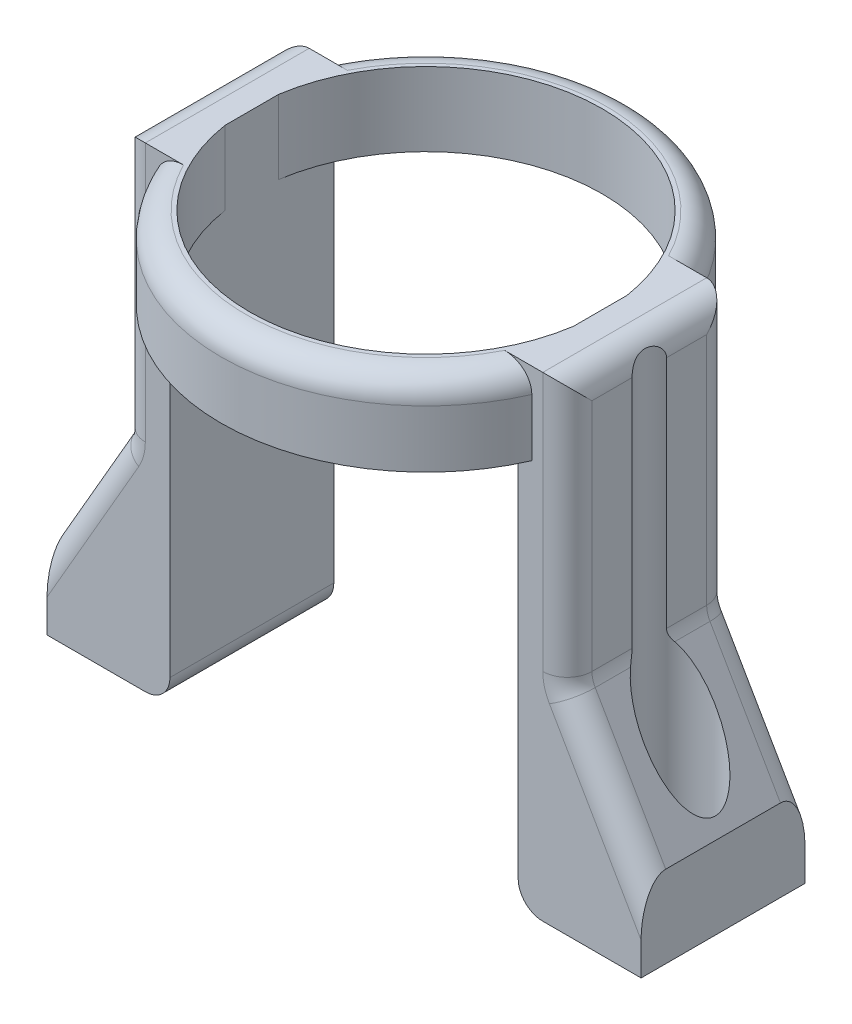
from build123d import *
from OCP.BRepFilletAPI import BRepFilletAPI_MakeChamfer

# Parameters (mm, degrees)
SKETCH_1_R          = 25
SKETCH_1_R_2        = 21.5
EXTRUDE_1_DEPTH     = 10
SKETCH_2_W          = 6
SKETCH_2_H          = 20
EXTRUDE_2_DEPTH     = 58
SKETCH_3_W          = 15
SKETCH_3_H          = 20
EXTRUDE_3_DEPTH     = 10
SKETCH_4_R          = 2.3
CUT_EXTRUDE_1_DEPTH = 73.822129192
CHAMFER_2_SIZE      = 15.588457268
CHAMFER_2_SIZE_2    = 9
FILLET_1_R          = 3
SKETCH_5_R          = 4.3
CUT_EXTRUDE_2_DEPTH = 55
CHAMFER_3_SIZE      = 1
CHAMFER_3_SIZE2     = 1.732050808


with BuildPart() as part:
    # Эскиз1 → Бобышка-Вытянуть1 (new body)
    with BuildSketch(Plane(origin=(0, 0, 0), x_dir=(1, 0, 0), z_dir=(0, 1, 0))):
        with Locations(Location((0, 0, 0), (0, 0, 270))):
            Circle(SKETCH_1_R)
        with Locations(Location((0, 0, 0), (0, 0, 270))):
            Circle(SKETCH_1_R_2, mode=Mode.SUBTRACT)
    extrude(amount=EXTRUDE_1_DEPTH)

    # Эскиз2 → Бобышка-Вытянуть2 (add)
    with BuildSketch(Plane(origin=(0, 10, 0), x_dir=(-1, 0, 0), z_dir=(0, -1, 0))):
        with Locations((-24.25, 0)):
            Rectangle(SKETCH_2_W, SKETCH_2_H)
        with Locations((24.25, 0)):
            Rectangle(SKETCH_2_W, SKETCH_2_H)
    extrude(amount=EXTRUDE_2_DEPTH)

    # Эскиз3 → Бобышка-Вытянуть3 (add)
    with BuildSketch(Plane.XZ.offset(48)):
        with Locations((28.75, 0)):
            Rectangle(SKETCH_3_W, SKETCH_3_H)
        with Locations((-28.75, 0)):
            Rectangle(SKETCH_3_W, SKETCH_3_H)
    extrude(amount=-EXTRUDE_3_DEPTH)

    # Эскиз4 → Вырез-Вытянуть1 (cut, through all)
    with BuildSketch(Plane.XZ.offset(48)):
        with Locations(Location((31, 0, 0), (0, 0, 270))):
            Circle(SKETCH_4_R)
        with Locations(Location((-31, 0, 0), (0, 0, 270))):
            Circle(SKETCH_4_R)
    extrude(amount=-CUT_EXTRUDE_1_DEPTH, mode=Mode.SUBTRACT)

    # Фаска2
    # the kernel refuses this chamfer: 15.588457268, 9 mm, written as the material it adds along each edge
    with BuildSketch(Plane(origin=(27.25, -38, 10), x_dir=(-0.01932676561270058, 0.9998132206222079, 0), z_dir=(0, 0, -1))) as chamfer_2_piece_1_section:
        Polygon((CHAMFER_2_SIZE * 0.99981322063, CHAMFER_2_SIZE * 0.0193267656128), (-CHAMFER_2_SIZE_2 * 0.0193267656127, CHAMFER_2_SIZE_2 * 0.999813220622), (0, 0), align=None)
    chamfer_2_piece_1 = extrude(amount=20, mode=Mode.PRIVATE)
    chamfer_2_piece_1 = split(chamfer_2_piece_1, bisect_by=Plane(origin=(36.25, -24.615994123, -6.666666667), z_dir=(-1, 0, 0)), keep=Keep.TOP, mode=Mode.PRIVATE)
    chamfer_2_piece_1 = chamfer_2_piece_1 - Plane(origin=(31, -24.615994123, 0), x_dir=(0, 0, -1), z_dir=(0, -1, 0)) * Cylinder(2.3, 103, mode=Mode.PRIVATE)
    add(chamfer_2_piece_1)
    with BuildSketch(Plane(origin=(-27.25, -38, -10), x_dir=(-0.9983227437537927, -0.0578938624026717, 0), z_dir=(0, 0, 1))) as chamfer_2_piece_2_section:
        Polygon((CHAMFER_2_SIZE_2 * 0.998322743754, -CHAMFER_2_SIZE_2 * 0.0578938624027), (-CHAMFER_2_SIZE * 0.0578938624031, -CHAMFER_2_SIZE * 0.998322743761), (0, 0), align=None)
    chamfer_2_piece_2 = extrude(amount=20, mode=Mode.PRIVATE)
    chamfer_2_piece_2 = split(chamfer_2_piece_2, bisect_by=Plane(origin=(-36.25, -35.368298987, 6.666666667), z_dir=(1, 0, 0)), keep=Keep.TOP, mode=Mode.PRIVATE)
    chamfer_2_piece_2 = chamfer_2_piece_2 - Plane(origin=(-31, -35.368298987, 0), x_dir=(0, 0, -1), z_dir=(0, -1, 0)) * Cylinder(2.3, 103, mode=Mode.PRIVATE)
    add(chamfer_2_piece_2)

    # Скругление1
    fillet_1_edges = [part.edges().sort_by_distance(p)[0] for p in [
        (27.25, -6.205771366, -10),
        (27.25, -6.205771366, 10),
        (27.25, -22.411542732, 0),
        (-27.25, -6.205771366, -10),
        (-27.25, -6.205771366, 10),
        (-27.25, -22.411542732, 0),
        (31.75, -30.205771366, 10),
        (31.75, -30.205771366, -10),
        (-31.75, -30.205771366, 10),
        (-31.75, -30.205771366, -10),
        (0, 10, -25),
        (27.25, 10, 0),
        (21.25, -48, 0),
        (0, 10, 25),
        (-27.25, 10, 0),
        (-21.25, -48, 0),
    ]]
    fillet(fillet_1_edges, radius=FILLET_1_R)

    # Эскиз5 → Вырез-Вытянуть2 (cut)
    with BuildSketch(Plane(origin=(0, 10, 0), x_dir=(1, 0, 0), z_dir=(0, 1, 0))):
        with Locations(Location((31, 0, 0), (0, 0, 270))):
            Circle(SKETCH_5_R)
        with Locations(Location((-31, 0, 0), (0, 0, 321.134589702))):
            Circle(SKETCH_5_R)
    extrude(amount=-CUT_EXTRUDE_2_DEPTH, mode=Mode.SUBTRACT)

    # Фаска3: one chamfer whose edges measure the first distance from different faces: ONE call of the kernel's chamfer builder (chamfer() names one face for all edges)
    chamfer_3_edges_1 = [part.edges().sort_by_distance(p)[0] for p in [
        (0, 0, -21.5),
    ]]
    chamfer_3_side_1 = [part.faces().sort_by_distance(p)[0] for p in [
        (0, 5, -21.5),
    ]]
    chamfer_3_edges_2 = [part.edges().sort_by_distance(p)[0] for p in [
        (0, 0, 21.5),
    ]]
    chamfer_3_side_2 = [part.faces().sort_by_distance(p)[0] for p in [
        (0, 5, 21.5),
    ]]
    chamfer_3 = BRepFilletAPI_MakeChamfer(part.part.solid().wrapped)
    for e in chamfer_3_edges_1:
        chamfer_3.Add(CHAMFER_3_SIZE, CHAMFER_3_SIZE2, e.wrapped, chamfer_3_side_1[0].wrapped)  # the first distance lies on this face
    for e in chamfer_3_edges_2:
        chamfer_3.Add(CHAMFER_3_SIZE, CHAMFER_3_SIZE2, e.wrapped, chamfer_3_side_2[0].wrapped)  # the first distance lies on this face
    add(Compound.cast(chamfer_3.Shape()), mode=Mode.REPLACE)


solid = part.part
